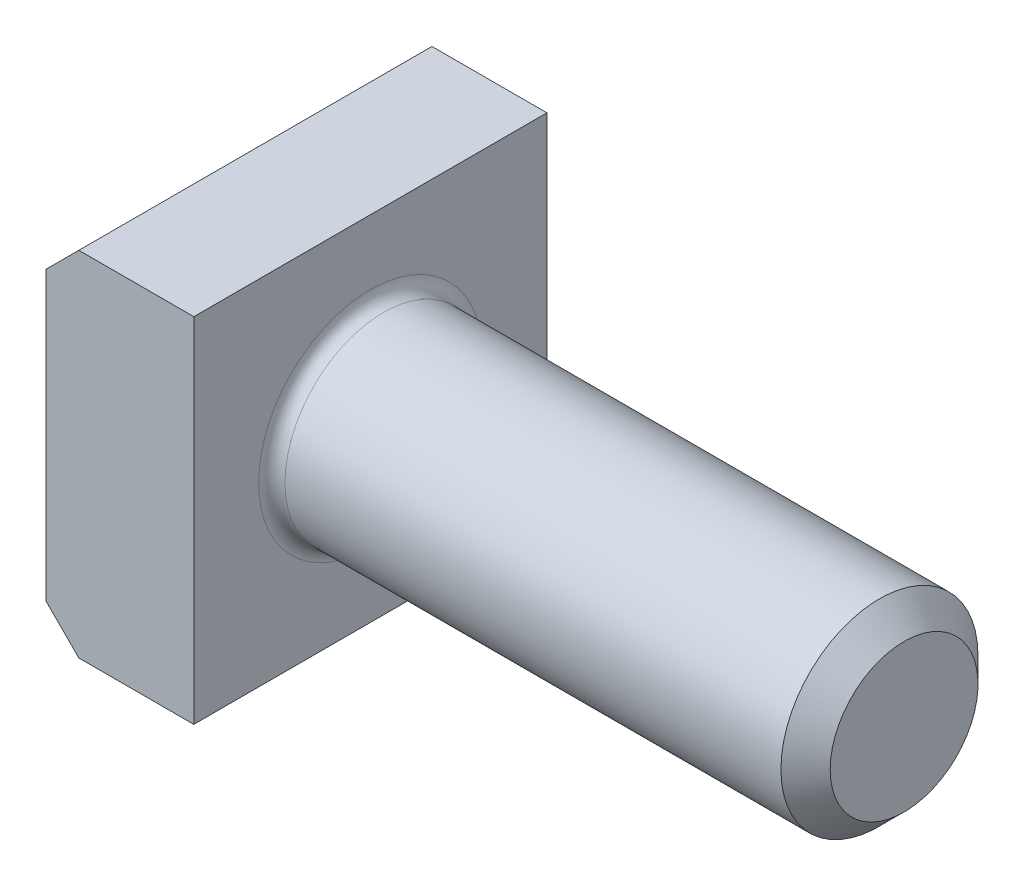
from build123d import *

# Parameters (mm, degrees)
BASEBODYSKE_W = 65
BASEBODYSKE_H = 12
HEAD_DEPTH    = 21.5
FILLET_2_R    = 1.6


with BuildPart() as part:
    # BaseBodySke → BaseBody (revolve)
    with BuildSketch(Plane.XY):
        with Locations((32.5, 6)):
            Rectangle(BASEBODYSKE_W, BASEBODYSKE_H)
    revolve(axis=Axis((65, 0, 0), (-1, 0, 0)))

    # HeadSke → Head (add, symmetric)
    with BuildSketch(Plane.XY):
        Polygon((-14, 21.5), (0, 21.5), (0, -21.5), (-14, -21.5), (-18, -17.5), (-18, 17.5), align=None)
    extrude(amount=HEAD_DEPTH, both=True)

    # FlatEndSke → FlatEnd (revolve, cut)
    with BuildSketch(Plane.XY):
        Polygon((62, 12), (65, 12), (65, 9), align=None)
    revolve(axis=Axis((0, 0, 0), (1, 0, 0)), mode=Mode.SUBTRACT)

    # Fillet 2
    fillet_2_edges = [part.edges().sort_by_distance(p)[0] for p in [
        (0, -12, 0),
    ]]
    fillet(fillet_2_edges, radius=FILLET_2_R)


solid = part.part
